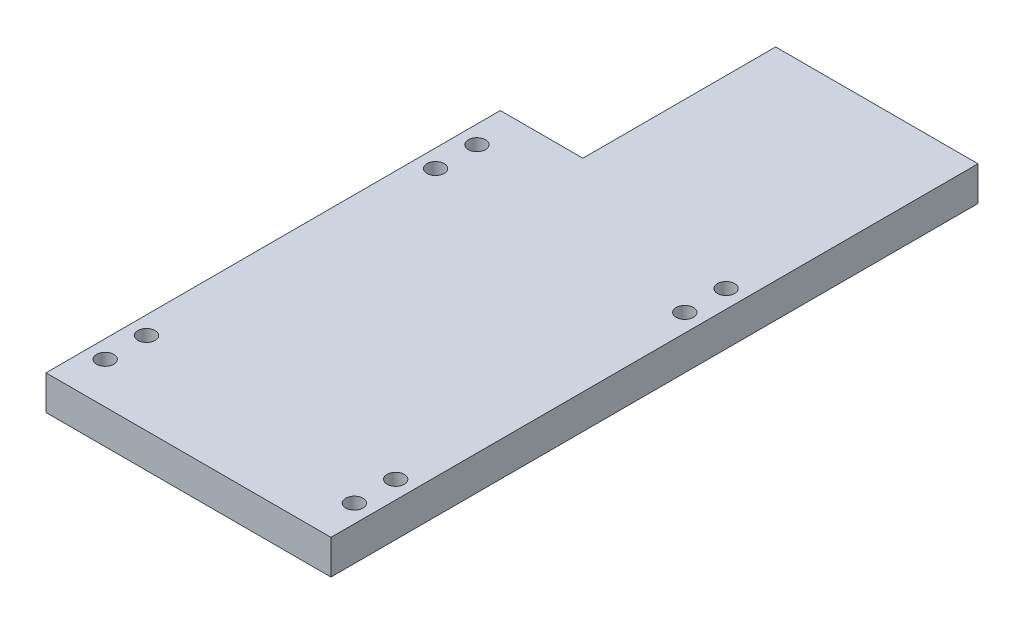
from build123d import *

# Parameters (mm, degrees)
SKETCH1_W           = 53.594
SKETCH1_H           = 76.2
BOSS_EXTRUDE1_DEPTH = 6.35
SKETCH2_R           = 1.5875
HOLE_CUTS_1_DEPTH   = 94.376010495
SKETCH6_W           = 53.594
SKETCH6_H           = 6.35
BOSS_EXTRUDE3_DEPTH = 7.62
HOLE_CUTS_2_REACH   = 95.376
SKETCH7_R           = 1.5875
CUT_EXTRUDE2_REACH  = 95.376
SKETCH3_W           = 0.508
SKETCH3_H           = 83.82
SKETCH8_W           = 37.338
SKETCH8_H           = 6.35
BOSS_EXTRUDE4_DEPTH = 35.56


with BuildPart() as part:
    # Sketch1 → Boss-Extrude1 (new body)
    with BuildSketch(Plane(origin=(0, 0, 0), x_dir=(1, 0, 0), z_dir=(0, 1, 0))):
        with Locations((-26.797, 38.1)):
            Rectangle(SKETCH1_W, SKETCH1_H)
    extrude(amount=BOSS_EXTRUDE1_DEPTH)

    # Sketch2 → Hole Cuts 1 (cut, through all)
    with BuildSketch(Plane(origin=(0, 6.35, 0), x_dir=(1, 0, 0), z_dir=(0, 1, 0))):
        with Locations((-3.81, 7.62)):
            Circle(SKETCH2_R)
        with Locations((-3.81, 68.58)):
            Circle(SKETCH2_R)
    hole_cuts_1 = extrude(amount=-HOLE_CUTS_1_DEPTH, mode=Mode.SUBTRACT)

    # Sketch6 → Boss-Extrude3 (add)
    with BuildSketch(Plane.XY):
        with Locations((-26.797, 3.175)):
            Rectangle(SKETCH6_W, SKETCH6_H)
    extrude(amount=BOSS_EXTRUDE3_DEPTH)

    # Sketch7 → Hole Cuts 2 (cut, up to next)
    with BuildSketch(Plane(origin=(0, 6.35, 0), x_dir=(1, 0, 0), z_dir=(0, 1, 0)), mode=Mode.PRIVATE) as hole_cuts_2_sk1:
        with Locations((-3.81, 0)):
            Circle(SKETCH7_R)
    hole_cuts_2_tool1 = extrude(hole_cuts_2_sk1.sketch, amount=-HOLE_CUTS_2_REACH, mode=Mode.PRIVATE) & part.part
    # Sketch7 → Hole Cuts 2 (cut, up to next)
    with BuildSketch(Plane(origin=(0, 6.35, 0), x_dir=(1, 0, 0), z_dir=(0, 1, 0)), mode=Mode.PRIVATE) as hole_cuts_2_sk2:
        with Locations((-3.81, 60.96)):
            Circle(SKETCH7_R)
    hole_cuts_2_tool2 = extrude(hole_cuts_2_sk2.sketch, amount=-HOLE_CUTS_2_REACH, mode=Mode.PRIVATE) & part.part
    hole_cuts_2_1 = hole_cuts_2_tool1.solids().sort_by_distance((-3.81, 6.35, 0))[0]
    add(hole_cuts_2_1, mode=Mode.SUBTRACT)
    hole_cuts_2_2 = hole_cuts_2_tool2.solids().sort_by_distance((-3.81, 6.35, -60.96))[0]
    add(hole_cuts_2_2, mode=Mode.SUBTRACT)
    hole_cuts_2 = hole_cuts_2_1 + hole_cuts_2_2  # Hole Cuts 2 as one shape, for the pattern or mirror that repeats it

    # Sketch3 → Cut-Extrude2 (cut, up to next)
    with BuildSketch(Plane(origin=(0, 6.35, 0), x_dir=(1, 0, 0), z_dir=(0, 1, 0)), mode=Mode.PRIVATE) as cut_extrude2_sk1:
        with Locations((-0.254, 34.29)):
            Rectangle(SKETCH3_W, SKETCH3_H)
    cut_extrude2_tool1 = extrude(cut_extrude2_sk1.sketch, amount=-CUT_EXTRUDE2_REACH, mode=Mode.PRIVATE) & part.part
    cut_extrude2 = cut_extrude2_tool1.solids().sort_by_distance((-0.254, 6.35, -34.29))[0]
    add(cut_extrude2, mode=Mode.SUBTRACT)

    # Mirror1: Hole Cuts 1, Hole Cuts 2, Cut-Extrude2 across plane
    add(hole_cuts_1.mirror(Plane(origin=(-26.797, 0, 0), x_dir=(0, 0, 1), z_dir=(1, 0, 0))), mode=Mode.SUBTRACT)
    add(hole_cuts_2.mirror(Plane(origin=(-26.797, 0, 0), x_dir=(0, 0, 1), z_dir=(1, 0, 0))), mode=Mode.SUBTRACT)
    add(cut_extrude2.mirror(Plane(origin=(-26.797, 0, 0), x_dir=(0, 0, 1), z_dir=(1, 0, 0))), mode=Mode.SUBTRACT)

    # Sketch8 → Boss-Extrude4 (add)
    with BuildSketch(Plane(origin=(0, 0, -76.2), x_dir=(-1, 0, 0), z_dir=(0, 0, -1))):
        with Locations((19.177, 3.175)):
            Rectangle(SKETCH8_W, SKETCH8_H)
    extrude(amount=BOSS_EXTRUDE4_DEPTH)


solid = part.part
